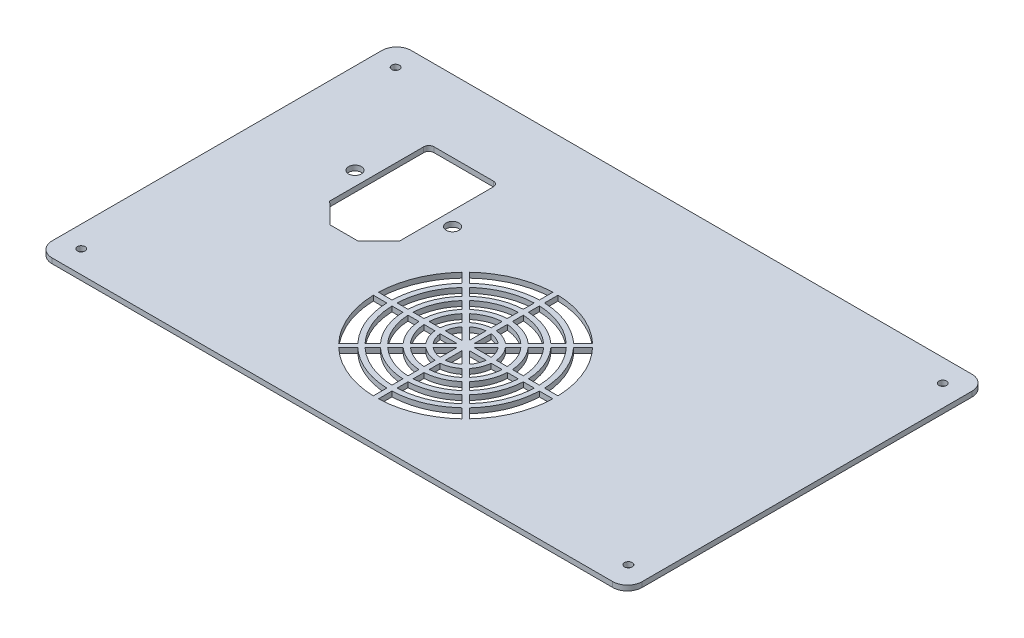
from build123d import *

# Parameters (mm, degrees)
SKETCH1_W          = 230
SKETCH1_H          = 140
BASE_FLANGE1_DEPTH = 2
SKETCH6_R          = 1.5
CUT_EXTRUDE1_DEPTH = 2
FILLET1_R          = 5.7366
SKETCH7_R          = 2.5
CUT_EXTRUDE2_DEPTH = 2
VENT1_START        = -2
VENT1_DEPTH        = 2


# Read off the part's stored shape, not the designer's step: Vent1
# Sheet-metal steps are written as plain solids
with BuildPart() as part:
    # Sketch1 → Base-Flange1 (new body)
    with BuildSketch(Plane(origin=(0, 0, 0), x_dir=(1, 0, 0), z_dir=(0, 1, 0))):
        with Locations((115, -70)):
            Rectangle(SKETCH1_W, SKETCH1_H)
    extrude(amount=-BASE_FLANGE1_DEPTH)

    # Sketch6 → Cut-Extrude1 (cut)
    with BuildSketch(Plane(origin=(0, 0, 0), x_dir=(1, 0, 0), z_dir=(0, 1, 0))):
        with Locations(Location((8.3683, -8.7366, 0), (0, 0, 270))):
            Circle(SKETCH6_R)
        with Locations(Location((221.6317, -8.7366, 0), (0, 0, 270))):
            Circle(SKETCH6_R)
        with Locations(Location((221.6317, -131.2634, 0), (0, 0, 270))):
            Circle(SKETCH6_R)
        with Locations(Location((8.3683, -131.2634, 0), (0, 0, 270))):
            Circle(SKETCH6_R)
    extrude(amount=-CUT_EXTRUDE1_DEPTH, mode=Mode.SUBTRACT)

    # Fillet1
    fillet1_edges = [part.edges().sort_by_distance(p)[0] for p in [
        (0, -1, 0),
        (230, -1, 0),
        (230, -1, 140),
        (0, -1, 140),
    ]]
    fillet(fillet1_edges, radius=FILLET1_R)

    # Sketch7 → Cut-Extrude2 (cut)
    with BuildSketch(Plane.XZ.offset(2)):
        with Locations(Location((73.235902522, 51.391264186, 0), (0, 0, 270))):
            Circle(SKETCH7_R)
        with Locations(Location((35.195902522, 51.391264186, 0), (0, 0, 270))):
            Circle(SKETCH7_R)
        with BuildLine():
            Line((67.770902522, 66.694736831), (67.770902522, 30.064484949))
            ThreePointArc((67.770902522, 30.064484949), (67.185116084, 28.650271387), (65.770902522, 28.064484949))
            Line((65.770902522, 28.064484949), (42.660902522, 28.064484949))
            ThreePointArc((42.660902522, 28.064484949), (41.246688959, 28.650271387), (40.660902522, 30.064484949))
            Line((40.660902522, 30.064484949), (40.660902522, 66.694736831))
            Line((40.660902522, 66.694736831), (48.665902522, 74.684484949))
            Line((48.665902522, 74.684484949), (59.765902522, 74.684484949))
            Line((59.765902522, 74.684484949), (67.770902522, 66.694736831))
        make_face()
    extrude(amount=-CUT_EXTRUDE2_DEPTH, mode=Mode.SUBTRACT)

    # Vent1 outline → Vent1 (cut)
    with BuildSketch(Plane(origin=(0, 0, 0), x_dir=(1, 0, 0), z_dir=(0, 1, 0)).offset(VENT1_START)):
        with BuildLine():
            Line((94.186797111, -68.665322523), (90.472699187, -64.951226366))
            add(Edge.make_bspline(
                [(90.472699187, -64.951226366), (89.128830106, -66.374339487), (86.471469748, -69.707863337), (83.374186624, -75.502472495), (81.466889147, -81.789989649), (80.988769346, -86.026184309), (80.932735322, -87.982736004)],
                knots=[0.37954792, 0.37954792, 0.37954792, 0.37954792, 0.40625, 0.4375, 0.46875, 0.495452077, 0.495452077, 0.495452077, 0.495452077], degree=3))
            Line((80.932735322, -87.982736004), (86.185261736, -87.982737116))
            add(Edge.make_bspline(
                [(94.186797111, -68.665322523), (93.08478886, -69.844177112), (90.864816202, -72.643423988), (88.255820579, -77.524511485), (86.649209074, -82.820799832), (86.239600332, -86.369923764), (86.185261736, -87.982737116)],
                knots=[0.380350766, 0.380350766, 0.380350766, 0.380350766, 0.40625, 0.4375, 0.46875, 0.49464923, 0.49464923, 0.49464923, 0.49464923], degree=3))
        make_face()
        with BuildLine():
            Line((145.651564253, -87.98273737), (150.904090665, -87.982736222))
            add(Edge.make_bspline(
                [(150.904090665, -87.982736222), (150.848056651, -86.026184454), (150.369936854, -81.789989719), (148.462639356, -75.502472495), (145.365356319, -69.707863498), (142.707996103, -66.374339774), (141.364127169, -64.951226764)],
                knots=[0.004547922, 0.004547922, 0.004547922, 0.004547922, 0.03125, 0.0625, 0.09375, 0.120452077, 0.120452077, 0.120452077, 0.120452077], degree=3))
            Line((141.364127169, -64.951226764), (137.650029337, -68.665323023))
            add(Edge.make_bspline(
                [(145.651564253, -87.98273737), (145.597225668, -86.369923933), (145.187616931, -82.820799913), (143.581005401, -77.524511485), (140.972009887, -72.64342419), (138.752037406, -69.844177471), (137.650029337, -68.665323023)],
                knots=[0.005350769, 0.005350769, 0.005350769, 0.005350769, 0.03125, 0.0625, 0.09375, 0.11964923, 0.11964923, 0.11964923, 0.11964923], degree=3))
        make_face()
        with BuildLine():
            Line((95.601006963, -110.714351941), (91.88690692, -114.428446232))
            add(Edge.make_bspline(
                [(91.88690692, -114.428446232), (93.310020042, -115.772315314), (96.643543893, -118.429675674), (102.438153053, -121.526958798), (108.725670215, -123.434256278), (112.961864884, -123.912376079), (114.918416587, -123.968410102)],
                knots=[0.62954792, 0.62954792, 0.62954792, 0.62954792, 0.65625, 0.6875, 0.71875, 0.745452078, 0.745452078, 0.745452078, 0.745452078], degree=3))
            Line((114.918416587, -123.968410102), (114.918417674, -118.715883687))
            add(Edge.make_bspline(
                [(95.601006963, -110.714351941), (96.779860455, -111.816358772), (99.579106116, -114.03633006), (104.460192043, -116.645324843), (109.75648039, -118.251936349), (113.305604322, -118.661545091), (114.918417674, -118.715883687)],
                knots=[0.630350795, 0.630350795, 0.630350795, 0.630350795, 0.65625, 0.6875, 0.71875, 0.74464923, 0.74464923, 0.74464923, 0.74464923], degree=3))
        make_face()
        with BuildLine():
            Line((114.918418359, -59.249581155), (114.91841711, -53.997054748))
            add(Edge.make_bspline(
                [(114.91841711, -53.997054748), (112.961865231, -54.053088747), (108.725670382, -54.531208536), (102.438153053, -56.438506066), (96.643544056, -59.535789103), (93.310020332, -62.19314932), (91.886907322, -63.537018253)],
                knots=[0.25454792, 0.25454792, 0.25454792, 0.25454792, 0.28125, 0.3125, 0.34375, 0.370452077, 0.370452077, 0.370452077, 0.370452077], degree=3))
            Line((91.886907322, -63.537018253), (95.601003581, -67.251116085))
            add(Edge.make_bspline(
                [(114.918418359, -59.249581155), (113.305604778, -59.303919721), (109.75648061, -59.713528449), (104.460192043, -61.320140021), (99.579104748, -63.929135536), (96.779858029, -66.149108017), (95.601003581, -67.251116085)],
                knots=[0.255350766, 0.255350766, 0.255350766, 0.255350766, 0.28125, 0.3125, 0.34375, 0.36964923, 0.36964923, 0.36964923, 0.36964923], degree=3))
        make_face()
        with BuildLine():
            Line((86.185261713, -89.982727063), (80.932735306, -89.982728313))
            add(Edge.make_bspline(
                [(80.932735306, -89.982728313), (80.988769305, -91.939280191), (81.466889094, -96.17547504), (83.374186624, -102.46299237), (86.471469661, -108.257601366), (89.128829878, -111.591125091), (90.472698811, -113.014238101)],
                knots=[0.50454792, 0.50454792, 0.50454792, 0.50454792, 0.53125, 0.5625, 0.59375, 0.620452077, 0.620452077, 0.620452077, 0.620452077], degree=3))
            Line((90.472698811, -113.014238101), (94.186793465, -109.300138441))
            add(Edge.make_bspline(
                [(86.185261713, -89.982727063), (86.239600279, -91.595540645), (86.649209007, -95.144664813), (88.255820579, -100.440953379), (90.864815359, -105.3220393), (93.08478664, -108.121284954), (94.186793465, -109.300138441)],
                knots=[0.505350766, 0.505350766, 0.505350766, 0.505350766, 0.53125, 0.5625, 0.59375, 0.619649205, 0.619649205, 0.619649205, 0.619649205], degree=3))
        make_face()
        with BuildLine():
            Line((116.918407621, -118.71588371), (116.918408895, -123.968410116))
            add(Edge.make_bspline(
                [(116.918408895, -123.968410116), (118.874960766, -123.912376116), (123.111155606, -123.434256326), (129.398672928, -121.526958798), (135.193281932, -118.429675757), (138.526805662, -115.772315534), (139.949918677, -114.428446595)],
                knots=[0.75454792, 0.75454792, 0.75454792, 0.75454792, 0.78125, 0.8125, 0.84375, 0.870452078, 0.870452078, 0.870452078, 0.870452078], degree=3))
            Line((139.949918677, -114.428446595), (136.235822399, -110.714348779))
            add(Edge.make_bspline(
                [(116.918407621, -118.71588371), (118.531221203, -118.661545144), (122.080345371, -118.251936415), (127.376633937, -116.645324843), (132.257721232, -114.036329329), (135.056967952, -111.816356848), (136.235822399, -110.714348779)],
                knots=[0.755350766, 0.755350766, 0.755350766, 0.755350766, 0.78125, 0.8125, 0.84375, 0.86964923, 0.86964923, 0.86964923, 0.86964923], degree=3))
        make_face()
        with BuildLine():
            Line((136.2358229, -67.251116554), (139.949919057, -63.537018629))
            add(Edge.make_bspline(
                [(139.949919057, -63.537018629), (138.526805935, -62.193149549), (135.193282086, -59.53578919), (129.398672928, -56.438506066), (123.111155774, -54.53120859), (118.874961114, -54.053088788), (116.918409418, -53.997054764)],
                knots=[0.12954792, 0.12954792, 0.12954792, 0.12954792, 0.15625, 0.1875, 0.21875, 0.245452077, 0.245452077, 0.245452077, 0.245452077], degree=3))
            Line((116.918409418, -53.997054764), (116.918408306, -59.249581178))
            add(Edge.make_bspline(
                [(136.2358229, -67.251116554), (135.056968311, -66.149108302), (132.257721435, -63.929135644), (127.376633937, -61.320140021), (122.080345591, -59.713528516), (118.531221658, -59.303919774), (116.918408306, -59.249581178)],
                knots=[0.130350766, 0.130350766, 0.130350766, 0.130350766, 0.15625, 0.1875, 0.21875, 0.24464923, 0.24464923, 0.24464923, 0.24464923], degree=3))
        make_face()
        with BuildLine():
            Line((137.650028869, -109.300142342), (141.36412681, -113.014238481))
            add(Edge.make_bspline(
                [(141.36412681, -113.014238481), (142.707995885, -111.591125365), (145.365356237, -108.257601521), (148.462639356, -102.46299237), (150.369936865, -96.175475112), (150.848056659, -91.93928034), (150.904090668, -89.982728536)],
                knots=[0.87954792, 0.87954792, 0.87954792, 0.87954792, 0.90625, 0.9375, 0.96875, 0.995452079, 0.995452079, 0.995452079, 0.995452079], degree=3))
            Line((150.904090668, -89.982728536), (145.651564259, -89.982727316))
            add(Edge.make_bspline(
                [(137.650028869, -109.300142342), (138.752037121, -108.121287753), (140.972009778, -105.322040877), (143.581005401, -100.440953379), (145.187616949, -95.144664894), (145.597225682, -91.595540813), (145.651564259, -89.982727316)],
                knots=[0.880350766, 0.880350766, 0.880350766, 0.880350766, 0.90625, 0.9375, 0.96875, 0.994649232, 0.994649232, 0.994649232, 0.994649232], degree=3))
        make_face()
        with BuildLine():
            Line((133.227447493, -104.877553462), (136.234960592, -107.885066499))
            add(Edge.make_bspline(
                [(136.234960592, -107.885066499), (137.244941206, -106.799390827), (139.298356202, -104.203727912), (141.721335323, -99.670652812), (143.213398497, -94.751979707), (143.596825678, -91.464585196), (143.650350168, -89.982732432)],
                knots=[0.880736599, 0.880736599, 0.880736599, 0.880736599, 0.90625, 0.9375, 0.96875, 0.994263401, 0.994263401, 0.994263401, 0.994263401], degree=3))
            Line((143.650350168, -89.982732432), (139.397084398, -89.982732389))
            add(Edge.make_bspline(
                [(133.227447493, -104.877553462), (134.042177631, -103.990225054), (135.741844588, -101.827308679), (137.769536407, -98.033764105), (139.018182863, -93.917528383), (139.345749668, -91.186269522), (139.397084398, -89.982732389)],
                knots=[0.881774646, 0.881774646, 0.881774646, 0.881774646, 0.90625, 0.9375, 0.96875, 0.993225354, 0.993225354, 0.993225354, 0.993225354], degree=3))
        make_face()
        with BuildLine():
            Line((139.397084398, -87.982732471), (143.650350168, -87.982732433))
            add(Edge.make_bspline(
                [(143.650350168, -87.982732433), (143.596825678, -86.500879669), (143.213398497, -83.213485158), (141.721335323, -78.294812053), (139.298356205, -73.761736958), (137.244941214, -71.166074047), (136.234960605, -70.08039838)],
                knots=[0.005736599, 0.005736599, 0.005736599, 0.005736599, 0.03125, 0.0625, 0.09375, 0.119263401, 0.119263401, 0.119263401, 0.119263401], degree=3))
            Line((136.234960605, -70.08039838), (133.227447497, -73.087911407))
            add(Edge.make_bspline(
                [(139.397084398, -87.982732471), (139.345749668, -86.77919534), (139.018182862, -84.047936481), (137.769536407, -79.93170076), (135.741844589, -76.138156188), (134.042177633, -73.975239813), (133.227447497, -73.087911407)],
                knots=[0.006774646, 0.006774646, 0.006774646, 0.006774646, 0.03125, 0.0625, 0.09375, 0.118225354, 0.118225354, 0.118225354, 0.118225354], degree=3))
        make_face()
        with BuildLine():
            Line((92.439741583, -89.982732389), (88.186475813, -89.982732432))
            add(Edge.make_bspline(
                [(88.186475813, -89.982732432), (88.240000302, -91.464585196), (88.623427483, -94.751979707), (90.115490657, -99.670652812), (92.538469776, -104.203727907), (94.591884767, -106.799390817), (95.601865376, -107.885066485)],
                knots=[0.505736599, 0.505736599, 0.505736599, 0.505736599, 0.53125, 0.5625, 0.59375, 0.619263401, 0.619263401, 0.619263401, 0.619263401], degree=3))
            Line((95.601865376, -107.885066485), (98.609378471, -104.877553444))
            add(Edge.make_bspline(
                [(92.439741583, -89.982732389), (92.491076312, -91.186269521), (92.818643118, -93.917528383), (94.067289573, -98.033764105), (96.094981389, -101.827308671), (97.79464834, -103.990225042), (98.609378471, -104.877553444)],
                knots=[0.506774646, 0.506774646, 0.506774646, 0.506774646, 0.53125, 0.5625, 0.59375, 0.618225354, 0.618225354, 0.618225354, 0.618225354], degree=3))
        make_face()
        with BuildLine():
            Line((98.609378474, -73.087911417), (95.601865376, -70.08039838))
            add(Edge.make_bspline(
                [(95.601865376, -70.08039838), (94.591884767, -71.166074048), (92.538469776, -73.761736958), (90.115490657, -78.294812053), (88.623427483, -83.213485158), (88.240000302, -86.500879669), (88.186475813, -87.982732433)],
                knots=[0.380736599, 0.380736599, 0.380736599, 0.380736599, 0.40625, 0.4375, 0.46875, 0.494263401, 0.494263401, 0.494263401, 0.494263401], degree=3))
            Line((88.186475813, -87.982732433), (92.439741583, -87.982732471))
            add(Edge.make_bspline(
                [(98.609378474, -73.087911417), (97.794648342, -73.975239821), (96.094981389, -76.138156192), (94.067289573, -79.93170076), (92.818643118, -84.047936481), (92.491076313, -86.77919534), (92.439741583, -87.982732471)],
                knots=[0.381774646, 0.381774646, 0.381774646, 0.381774646, 0.40625, 0.4375, 0.46875, 0.493225354, 0.493225354, 0.493225354, 0.493225354], degree=3))
        make_face()
        with BuildLine():
            Line((116.918412928, -112.461403841), (116.918412971, -116.71466961))
            add(Edge.make_bspline(
                [(116.918412971, -116.71466961), (118.400265741, -116.661145122), (121.687660259, -116.277717941), (126.606333369, -114.785654765), (131.139408465, -112.362675647), (133.735071375, -110.309260656), (134.820747043, -109.299280047)],
                knots=[0.755736599, 0.755736599, 0.755736599, 0.755736599, 0.78125, 0.8125, 0.84375, 0.869263401, 0.869263401, 0.869263401, 0.869263401], degree=3))
            Line((134.820747043, -109.299280047), (131.813234002, -106.291766952))
            add(Edge.make_bspline(
                [(116.918412928, -112.461403841), (118.121950066, -112.410069112), (120.853208934, -112.082502307), (124.969444663, -110.83385585), (128.762989229, -108.806164034), (130.9259056, -107.106497083), (131.813234002, -106.291766952)],
                knots=[0.756774646, 0.756774646, 0.756774646, 0.756774646, 0.78125, 0.8125, 0.84375, 0.868225354, 0.868225354, 0.868225354, 0.868225354], degree=3))
        make_face()
        with BuildLine():
            Line((100.023591961, -106.291766936), (97.016078924, -109.299280034))
            add(Edge.make_bspline(
                [(97.016078924, -109.299280034), (98.101754595, -110.309260648), (100.69741751, -112.362675644), (105.230492611, -114.785654765), (110.149165716, -116.27771794), (113.436560227, -116.66114512), (114.918412991, -116.71466961)],
                knots=[0.630736599, 0.630736599, 0.630736599, 0.630736599, 0.65625, 0.6875, 0.71875, 0.744263401, 0.744263401, 0.744263401, 0.744263401], degree=3))
            Line((114.918412991, -116.71466961), (114.918413029, -112.46140384))
            add(Edge.make_bspline(
                [(100.023591961, -106.291766936), (100.910920368, -107.106497073), (103.073836744, -108.80616403), (106.867381318, -110.83385585), (110.983617038, -112.082502304), (113.714875898, -112.41006911), (114.918413029, -112.46140384)],
                knots=[0.631774646, 0.631774646, 0.631774646, 0.631774646, 0.65625, 0.6875, 0.71875, 0.743225354, 0.743225354, 0.743225354, 0.743225354], degree=3))
        make_face()
        with BuildLine():
            Line((131.813234005, -71.673697916), (134.820747043, -68.666184818))
            add(Edge.make_bspline(
                [(134.820747043, -68.666184818), (133.735071375, -67.656204209), (131.139408465, -65.602789218), (126.606333369, -63.179810099), (121.687660265, -61.687746925), (118.400265754, -61.304319744), (116.91841299, -61.250795255)],
                knots=[0.130736599, 0.130736599, 0.130736599, 0.130736599, 0.15625, 0.1875, 0.21875, 0.244263401, 0.244263401, 0.244263401, 0.244263401], degree=3))
            Line((116.91841299, -61.250795255), (116.918412933, -65.504061024))
            add(Edge.make_bspline(
                [(131.813234005, -71.673697916), (130.925905602, -70.858967784), (128.762989231, -69.159300832), (124.969444663, -67.131609015), (120.853208936, -65.882962559), (118.12195007, -65.555395753), (116.918412933, -65.504061024)],
                knots=[0.131774646, 0.131774646, 0.131774646, 0.131774646, 0.15625, 0.1875, 0.21875, 0.243225354, 0.243225354, 0.243225354, 0.243225354], degree=3))
        make_face()
        with BuildLine():
            Line((114.918413034, -65.504061025), (114.918412991, -61.250795255))
            add(Edge.make_bspline(
                [(114.918412991, -61.250795255), (113.436560226, -61.304319744), (110.149165716, -61.687746925), (105.230492611, -63.179810099), (100.697417516, -65.602789218), (98.101754605, -67.656204209), (97.016078938, -68.666184818)],
                knots=[0.255736599, 0.255736599, 0.255736599, 0.255736599, 0.28125, 0.3125, 0.34375, 0.369263401, 0.369263401, 0.369263401, 0.369263401], degree=3))
            Line((97.016078938, -68.666184818), (100.023591965, -71.673697926))
            add(Edge.make_bspline(
                [(114.918413034, -65.504061025), (113.714875901, -65.555395754), (110.98361704, -65.88296256), (106.867381318, -67.131609015), (103.073836746, -69.159300834), (100.910920371, -70.85896779), (100.023591965, -71.673697926)],
                knots=[0.256774646, 0.256774646, 0.256774646, 0.256774646, 0.28125, 0.3125, 0.34375, 0.368225354, 0.368225354, 0.368225354, 0.368225354], degree=3))
        make_face()
        with BuildLine():
            Line((124.371451257, -96.021568152), (127.385651673, -99.035766676))
            add(Edge.make_bspline(
                [(127.385651673, -99.035766676), (127.823703314, -98.536044965), (128.838066301, -97.214187782), (130.098397335, -94.856274262), (130.874505355, -92.297789001), (131.091936585, -90.645831874), (131.13554391, -89.982725977)],
                knots=[0.88544388, 0.88544388, 0.88544388, 0.88544388, 0.90625, 0.9375, 0.96875, 0.98955612, 0.98955612, 0.98955612, 0.98955612], degree=3))
            Line((131.13554391, -89.982725977), (126.872822184, -89.982724157))
            add(Edge.make_bspline(
                [(124.371451257, -96.021568152), (124.618548078, -95.724819091), (125.281645675, -94.837598322), (126.14659842, -93.219385556), (126.679233737, -91.463522228), (126.83771275, -90.367281432), (126.872822184, -89.982724157)],
                knots=[0.889488586, 0.889488586, 0.889488586, 0.889488586, 0.90625, 0.9375, 0.96875, 0.985511421, 0.985511421, 0.985511421, 0.985511421], degree=3))
        make_face()
        with BuildLine():
            add(Edge.make_bspline(
                [(128.802561778, -100.452675705), (129.331470922, -99.85848889), (130.511700542, -98.332536922), (131.958067413, -95.62657483), (132.848735728, -92.690434886), (133.093198346, -90.776875559), (133.139356632, -89.982726815)],
                knots=[0.884231557, 0.884231557, 0.884231557, 0.884231557, 0.90625, 0.9375, 0.96875, 0.990768442, 0.990768442, 0.990768442, 0.990768442], degree=3))
            Line((128.802561778, -100.452675705), (131.811831191, -103.461937161))
            add(Edge.make_bspline(
                [(131.811831191, -103.461937161), (132.534878298, -102.66817195), (134.068195001, -100.70898825), (135.909866329, -97.263463537), (137.043961932, -93.524851369), (137.345095373, -91.055280657), (137.395100625, -89.982732388)],
                knots=[0.88240528, 0.88240528, 0.88240528, 0.88240528, 0.90625, 0.9375, 0.96875, 0.99259472, 0.99259472, 0.99259472, 0.99259472], degree=3))
            Line((137.395100625, -89.982732388), (133.139356632, -89.982726815))
        make_face()
        with BuildLine():
            Line((126.872822079, -87.982739563), (131.135543874, -87.982738353))
            add(Edge.make_bspline(
                [(131.135543874, -87.982738353), (131.091936538, -87.319632635), (130.874505302, -85.667675692), (130.098397335, -83.109190602), (128.838066385, -80.751277238), (127.823703528, -79.429420179), (127.38565202, -78.929698585)],
                knots=[0.010443886, 0.010443886, 0.010443886, 0.010443886, 0.03125, 0.0625, 0.09375, 0.114556114, 0.114556114, 0.114556114, 0.114556114], degree=3))
            Line((127.38565202, -78.929698585), (124.371451369, -81.943896846))
            add(Edge.make_bspline(
                [(126.872822079, -87.982739563), (126.837712641, -87.598182673), (126.679233625, -86.501942269), (126.14659842, -84.746079309), (125.281645703, -83.127866594), (124.618548148, -82.240645867), (124.371451369, -81.943896846)],
                knots=[0.014488596, 0.014488596, 0.014488596, 0.014488596, 0.03125, 0.0625, 0.09375, 0.110511411, 0.110511411, 0.110511411, 0.110511411], degree=3))
        make_face()
        with BuildLine():
            add(Edge.make_bspline(
                [(133.139356609, -87.982737658), (133.093198313, -87.188589045), (132.84873569, -85.275029852), (131.958067413, -82.338890035), (130.511700627, -79.632928103), (129.331471143, -78.10697626), (128.802562137, -77.512789563)],
                knots=[0.009231562, 0.009231562, 0.009231562, 0.009231562, 0.03125, 0.0625, 0.09375, 0.115768438, 0.115768438, 0.115768438, 0.115768438], degree=3))
            Line((133.139356609, -87.982737658), (137.395100625, -87.982732472))
            add(Edge.make_bspline(
                [(137.395100625, -87.982732472), (137.345095373, -86.910184204), (137.043961931, -84.440613494), (135.909866329, -80.702001328), (134.068195002, -77.256476616), (132.5348783, -75.297292917), (131.811831194, -74.503527707)],
                knots=[0.00740528, 0.00740528, 0.00740528, 0.00740528, 0.03125, 0.0625, 0.09375, 0.11759472, 0.11759472, 0.11759472, 0.11759472], degree=3))
            Line((131.811831194, -74.503527707), (128.802562137, -77.512789563))
        make_face()
        with BuildLine():
            Line((104.964003841, -89.982724644), (100.701282071, -89.982725982))
            add(Edge.make_bspline(
                [(100.701282071, -89.982725982), (100.744889396, -90.645831878), (100.962320626, -92.297789002), (101.738428645, -94.856274262), (102.998759598, -97.21418763), (104.013122457, -98.536044691), (104.451173967, -99.035766287)],
                knots=[0.51044388, 0.51044388, 0.51044388, 0.51044388, 0.53125, 0.5625, 0.59375, 0.614556114, 0.614556114, 0.614556114, 0.614556114], degree=3))
            Line((104.451173967, -99.035766287), (107.465374618, -96.021568026))
            add(Edge.make_bspline(
                [(104.964003841, -89.982724644), (104.999113277, -90.367281755), (105.157592291, -91.463522384), (105.690227561, -93.219385556), (106.555180279, -94.837598274), (107.218277837, -95.724819003), (107.465374618, -96.021568026)],
                knots=[0.514488586, 0.514488586, 0.514488586, 0.514488586, 0.53125, 0.5625, 0.59375, 0.610511411, 0.610511411, 0.610511411, 0.610511411], degree=3))
        make_face()
        with BuildLine():
            add(Edge.make_bspline(
                [(98.697469345, -89.982726742), (98.743627629, -90.776875511), (98.988090245, -92.690434863), (99.878758567, -95.62657483), (101.325125353, -98.332536762), (102.505354838, -99.858488605), (103.034263844, -100.452675302)],
                knots=[0.509231557, 0.509231557, 0.509231557, 0.509231557, 0.53125, 0.5625, 0.59375, 0.615768438, 0.615768438, 0.615768438, 0.615768438], degree=3))
            Line((98.697469345, -89.982726742), (94.441725355, -89.982732388))
            add(Edge.make_bspline(
                [(94.441725355, -89.982732388), (94.491730607, -91.055280658), (94.792864049, -93.524851369), (95.926959651, -97.263463537), (97.768630976, -100.708988243), (99.301947673, -102.668171937), (100.024994773, -103.461937143)],
                knots=[0.50740528, 0.50740528, 0.50740528, 0.50740528, 0.53125, 0.5625, 0.59375, 0.61759472, 0.61759472, 0.61759472, 0.61759472], degree=3))
            Line((100.024994773, -103.461937143), (103.034263844, -100.452675302))
        make_face()
        with BuildLine():
            Line((107.465374723, -81.943896713), (104.451174307, -78.929698189))
            add(Edge.make_bspline(
                [(104.451174307, -78.929698189), (104.013122667, -79.4294199), (102.998759679, -80.751277083), (101.738428645, -83.109190602), (100.962320678, -85.667675694), (100.744889442, -87.319632638), (100.701282106, -87.982738358)],
                knots=[0.38544388, 0.38544388, 0.38544388, 0.38544388, 0.40625, 0.4375, 0.46875, 0.489556114, 0.489556114, 0.489556114, 0.489556114], degree=3))
            Line((100.701282106, -87.982738358), (104.964003857, -87.982740048))
            add(Edge.make_bspline(
                [(107.465374723, -81.943896713), (107.218277902, -82.240645774), (106.555180305, -83.127866542), (105.690227561, -84.746079309), (105.157592308, -86.501942425), (104.999113293, -87.598182995), (104.964003857, -87.982740048)],
                knots=[0.389488586, 0.389488586, 0.389488586, 0.389488586, 0.40625, 0.4375, 0.46875, 0.485511411, 0.485511411, 0.485511411, 0.485511411], degree=3))
        make_face()
        with BuildLine():
            add(Edge.make_bspline(
                [(103.034264203, -77.51278916), (102.505355059, -78.106975975), (101.325125438, -79.632927943), (99.878758567, -82.338890035), (98.988090298, -85.275029829), (98.743627674, -87.188588996), (98.697469376, -87.982737584)],
                knots=[0.384231557, 0.384231557, 0.384231557, 0.384231557, 0.40625, 0.4375, 0.46875, 0.490768438, 0.490768438, 0.490768438, 0.490768438], degree=3))
            Line((103.034264203, -77.51278916), (100.024994776, -74.503527719))
            add(Edge.make_bspline(
                [(100.024994776, -74.503527719), (99.301947675, -75.297292925), (97.768630976, -77.256476621), (95.926959651, -80.702001328), (94.792864049, -84.440613494), (94.491730608, -86.910184204), (94.441725356, -87.982732472)],
                knots=[0.38240528, 0.38240528, 0.38240528, 0.38240528, 0.40625, 0.4375, 0.46875, 0.49259472, 0.49259472, 0.49259472, 0.49259472], degree=3))
            Line((94.441725356, -87.982732472), (98.697469376, -87.982737584))
        make_face()
        with BuildLine():
            Line((116.918405201, -99.937141582), (116.91840654, -104.199863351))
            add(Edge.make_bspline(
                [(116.91840654, -104.199863351), (117.581512436, -104.156256026), (119.23346956, -103.938824796), (121.79195482, -103.162716778), (124.149868185, -101.902385827), (125.471725243, -100.88802297), (125.971446838, -100.449971462)],
                knots=[0.76044388, 0.76044388, 0.76044388, 0.76044388, 0.78125, 0.8125, 0.84375, 0.864556114, 0.864556114, 0.864556114, 0.864556114], degree=3))
            Line((125.971446838, -100.449971462), (122.957248576, -97.435770811))
            add(Edge.make_bspline(
                [(116.918405201, -99.937141582), (117.302962312, -99.902032146), (118.399202942, -99.743553132), (120.155066114, -99.210917862), (121.773278829, -98.345965145), (122.660499556, -97.68286759), (122.957248576, -97.435770811)],
                knots=[0.764488586, 0.764488586, 0.764488586, 0.764488586, 0.78125, 0.8125, 0.84375, 0.860511411, 0.860511411, 0.860511411, 0.860511411], degree=3))
        make_face()
        with BuildLine():
            add(Edge.make_bspline(
                [(116.9184073, -106.203676078), (117.712556069, -106.157517794), (119.626115421, -105.913055177), (122.562255388, -105.022386856), (125.26821732, -103.57602007), (126.794169163, -102.395790585), (127.38835586, -101.866881579)],
                knots=[0.759231557, 0.759231557, 0.759231557, 0.759231557, 0.78125, 0.8125, 0.84375, 0.865768438, 0.865768438, 0.865768438, 0.865768438], degree=3))
            Line((116.9184073, -106.203676078), (116.918412927, -110.459420068))
            add(Edge.make_bspline(
                [(116.918412927, -110.459420068), (117.990961203, -110.409414817), (120.460531921, -110.108281376), (124.199144095, -108.974185771), (127.644668801, -107.132514447), (129.603852495, -105.59919775), (130.397617701, -104.876150649)],
                knots=[0.75740528, 0.75740528, 0.75740528, 0.75740528, 0.78125, 0.8125, 0.84375, 0.86759472, 0.86759472, 0.86759472, 0.86759472], degree=3))
            Line((130.397617701, -104.876150649), (127.38835586, -101.866881579))
        make_face()
        with BuildLine():
            Line((108.879577263, -97.435770693), (105.86537874, -100.449971109))
            add(Edge.make_bspline(
                [(105.86537874, -100.449971109), (106.365100453, -100.888022752), (107.686957638, -101.902385742), (110.04487116, -103.162716778), (112.603356252, -103.938824745), (114.255313196, -104.15625598), (114.918418916, -104.199863317)],
                knots=[0.63544388, 0.63544388, 0.63544388, 0.63544388, 0.65625, 0.6875, 0.71875, 0.739556114, 0.739556114, 0.739556114, 0.739556114], degree=3))
            Line((114.918418916, -104.199863317), (114.918420606, -99.937141566))
            add(Edge.make_bspline(
                [(108.879577263, -97.435770693), (109.176326326, -97.682867516), (110.063547097, -98.345965116), (111.681759867, -99.210917862), (113.437622983, -99.743553115), (114.533863553, -99.902032129), (114.918420606, -99.937141566)],
                knots=[0.639488586, 0.639488586, 0.639488586, 0.639488586, 0.65625, 0.6875, 0.71875, 0.735511411, 0.735511411, 0.735511411, 0.735511411], degree=3))
        make_face()
        with BuildLine():
            add(Edge.make_bspline(
                [(104.44846971, -101.866881214), (105.042656528, -102.39579036), (106.568608498, -103.576019983), (109.274570592, -105.022386856), (112.210710387, -105.913055125), (114.124269554, -106.157517748), (114.918418142, -106.203676047)],
                knots=[0.634231557, 0.634231557, 0.634231557, 0.634231557, 0.65625, 0.6875, 0.71875, 0.740768438, 0.740768438, 0.740768438, 0.740768438], degree=3))
            Line((104.44846971, -101.866881214), (101.439208262, -104.876150633))
            add(Edge.make_bspline(
                [(101.439208262, -104.876150633), (102.232973473, -105.59919774), (104.192157173, -107.132514443), (107.637681886, -108.974185771), (111.376294052, -110.108281373), (113.845864762, -110.409414815), (114.91841303, -110.459420067)],
                knots=[0.63240528, 0.63240528, 0.63240528, 0.63240528, 0.65625, 0.6875, 0.71875, 0.74259472, 0.74259472, 0.74259472, 0.74259472], degree=3))
            Line((114.91841303, -110.459420067), (114.918418142, -106.203676047))
        make_face()
        with BuildLine():
            Line((122.95724871, -80.529694165), (125.971447233, -77.515493749))
            add(Edge.make_bspline(
                [(125.971447233, -77.515493749), (125.471725522, -77.077442109), (124.14986834, -76.063079121), (121.79195482, -74.802748087), (119.233469729, -74.02664012), (117.581512784, -73.809208884), (116.918407065, -73.765601548)],
                knots=[0.13544388, 0.13544388, 0.13544388, 0.13544388, 0.15625, 0.1875, 0.21875, 0.239556114, 0.239556114, 0.239556114, 0.239556114], degree=3))
            Line((116.918407065, -73.765601548), (116.918405375, -78.028323299))
            add(Edge.make_bspline(
                [(122.95724871, -80.529694165), (122.660499649, -80.282597345), (121.77327888, -79.619499747), (120.155066114, -78.754547003), (118.399202998, -78.22191175), (117.302962427, -78.063432736), (116.918405375, -78.028323299)],
                knots=[0.139488586, 0.139488586, 0.139488586, 0.139488586, 0.15625, 0.1875, 0.21875, 0.235511411, 0.235511411, 0.235511411, 0.235511411], degree=3))
        make_face()
        with BuildLine():
            add(Edge.make_bspline(
                [(127.388356263, -76.098583645), (126.794169448, -75.569674501), (125.26821748, -74.389444881), (122.562255388, -72.943078009), (119.626115594, -72.05240974), (117.712556426, -71.807947116), (116.918407838, -71.761788818)],
                knots=[0.134231557, 0.134231557, 0.134231557, 0.134231557, 0.15625, 0.1875, 0.21875, 0.240768438, 0.240768438, 0.240768438, 0.240768438], degree=3))
            Line((127.388356263, -76.098583645), (130.397617704, -73.089314218))
            add(Edge.make_bspline(
                [(130.397617704, -73.089314218), (129.603852497, -72.366267117), (127.644668802, -70.832950418), (124.199144095, -68.991279093), (120.460531922, -67.85718349), (117.990961205, -67.556050048), (116.918412931, -67.506044797)],
                knots=[0.13240528, 0.13240528, 0.13240528, 0.13240528, 0.15625, 0.1875, 0.21875, 0.24259472, 0.24259472, 0.24259472, 0.24259472], degree=3))
            Line((116.918412931, -67.506044797), (116.918407838, -71.761788818))
        make_face()
        with BuildLine():
            add(Edge.make_bspline(
                [(114.918418681, -71.761788787), (114.124269912, -71.807947071), (112.21071056, -72.052409688), (109.274570592, -72.943078009), (106.56860866, -74.389444795), (105.042656818, -75.56967428), (104.44847012, -76.098583286)],
                knots=[0.259231557, 0.259231557, 0.259231557, 0.259231557, 0.28125, 0.3125, 0.34375, 0.365768438, 0.365768438, 0.365768438, 0.365768438], degree=3))
            Line((114.918418681, -71.761788787), (114.918413034, -67.506044798))
            add(Edge.make_bspline(
                [(114.918413034, -67.506044798), (113.845864765, -67.556050049), (111.376294053, -67.857183491), (107.637681886, -68.991279093), (104.192157174, -70.832950421), (102.232973475, -72.366267123), (101.439208265, -73.089314229)],
                knots=[0.25740528, 0.25740528, 0.25740528, 0.25740528, 0.28125, 0.3125, 0.34375, 0.36759472, 0.36759472, 0.36759472, 0.36759472], degree=3))
            Line((101.439208265, -73.089314229), (104.44847012, -76.098583286))
        make_face()
        with BuildLine():
            Line((114.918420779, -78.028323283), (114.918419441, -73.765601513))
            add(Edge.make_bspline(
                [(114.918419441, -73.765601513), (114.255313545, -73.809208838), (112.60335642, -74.026640069), (110.04487116, -74.802748087), (107.686957796, -76.063079038), (106.365100737, -77.077441895), (105.865379143, -77.515493402)],
                knots=[0.26044388, 0.26044388, 0.26044388, 0.26044388, 0.28125, 0.3125, 0.34375, 0.364556114, 0.364556114, 0.364556114, 0.364556114], degree=3))
            Line((105.865379143, -77.515493402), (108.879577404, -80.529694054))
            add(Edge.make_bspline(
                [(114.918420779, -78.028323283), (114.533863668, -78.063432719), (113.437623039, -78.221911733), (111.681759867, -78.754547003), (110.063547152, -79.61949972), (109.176326425, -80.282597275), (108.879577404, -80.529694054)],
                knots=[0.264488586, 0.264488586, 0.264488586, 0.264488586, 0.28125, 0.3125, 0.34375, 0.360511411, 0.360511411, 0.360511411, 0.360511411], degree=3))
        make_face()
        with BuildLine():
            Line((118.332626553, -89.982732432), (122.950046382, -94.600162569))
            add(Edge.make_bspline(
                [(122.950046382, -94.600162569), (123.109229031, -94.400913837), (123.608095067, -93.719092719), (124.286928342, -92.449084988), (124.70495191, -91.071045961), (124.834320695, -90.236173712), (124.862651703, -89.982724101)],
                knots=[0.892720395, 0.892720395, 0.892720395, 0.892720395, 0.90625, 0.9375, 0.96875, 0.982279623, 0.982279623, 0.982279623, 0.982279623], degree=3))
            Line((124.862651703, -89.982724101), (118.332626553, -89.982732432))
        make_face()
        with BuildLine():
            Line((118.332626553, -87.982732432), (124.862651515, -87.982739083))
            add(Edge.make_bspline(
                [(124.862651515, -87.982739083), (124.834320522, -87.729290037), (124.704951746, -86.894418362), (124.286928342, -85.516379877), (123.608095003, -84.246372026), (123.109228871, -83.564550809), (122.950046128, -83.365301979)],
                knots=[0.017720407, 0.017720407, 0.017720407, 0.017720407, 0.03125, 0.0625, 0.09375, 0.107279612, 0.107279612, 0.107279612, 0.107279612], degree=3))
            Line((122.950046128, -83.365301979), (118.332626553, -87.982732432))
        make_face()
        with BuildLine():
            Line((113.504199428, -89.982732432), (106.974174394, -89.982725144))
            add(Edge.make_bspline(
                [(106.974174394, -89.982725144), (107.002505393, -90.236174405), (107.131874172, -91.071046297), (107.549897639, -92.449084988), (108.228730978, -93.719092839), (108.727597109, -94.400914055), (108.886779852, -94.600162886)],
                knots=[0.517720395, 0.517720395, 0.517720395, 0.517720395, 0.53125, 0.5625, 0.59375, 0.607279612, 0.607279612, 0.607279612, 0.607279612], degree=3))
            Line((108.886779852, -94.600162886), (113.504199428, -89.982732432))
        make_face()
        with BuildLine():
            Line((113.504199428, -87.982732432), (108.886779599, -83.365302296))
            add(Edge.make_bspline(
                [(108.886779599, -83.365302296), (108.727596949, -83.564551028), (108.228730914, -84.246372146), (107.549897639, -85.516379877), (107.131874133, -86.894418698), (107.002505351, -87.729290728), (106.974174349, -87.982740124)],
                knots=[0.392720395, 0.392720395, 0.392720395, 0.392720395, 0.40625, 0.4375, 0.46875, 0.482279612, 0.482279612, 0.482279612, 0.482279612], degree=3))
            Line((106.974174349, -87.982740124), (113.504199428, -87.982732432))
        make_face()
        with BuildLine():
            Line((116.91841299, -91.396945995), (116.918405702, -97.926971029))
            add(Edge.make_bspline(
                [(116.918405702, -97.926971029), (117.171854962, -97.89864003), (118.006726855, -97.76927125), (119.384765546, -97.351247784), (120.654773396, -96.672414445), (121.336594613, -96.173548314), (121.535843444, -96.01436557)],
                knots=[0.767720395, 0.767720395, 0.767720395, 0.767720395, 0.78125, 0.8125, 0.84375, 0.857279612, 0.857279612, 0.857279612, 0.857279612], degree=3))
            Line((121.535843444, -96.01436557), (116.91841299, -91.396945995))
        make_face()
        with BuildLine():
            Line((114.91841299, -91.396945995), (110.300982846, -96.014365818))
            add(Edge.make_bspline(
                [(110.300982846, -96.014365818), (110.500231581, -96.17354847), (111.182052701, -96.672414507), (112.452060435, -97.351247784), (113.830099256, -97.76927129), (114.664971286, -97.898640072), (114.918420682, -97.926971074)],
                knots=[0.642720395, 0.642720395, 0.642720395, 0.642720395, 0.65625, 0.6875, 0.71875, 0.732279612, 0.732279612, 0.732279612, 0.732279612], degree=3))
            Line((114.918420682, -97.926971074), (114.91841299, -91.396945995))
        make_face()
        with BuildLine():
            Line((116.91841299, -86.56851887), (121.535843127, -81.951099041))
            add(Edge.make_bspline(
                [(121.535843127, -81.951099041), (121.336594395, -81.791916391), (120.654773277, -81.293050356), (119.384765546, -80.614217081), (118.006726725, -80.196193575), (117.171854695, -80.066824793), (116.918405298, -80.038493791)],
                knots=[0.142720395, 0.142720395, 0.142720395, 0.142720395, 0.15625, 0.1875, 0.21875, 0.232279612, 0.232279612, 0.232279612, 0.232279612], degree=3))
            Line((116.918405298, -80.038493791), (116.91841299, -86.56851887))
        make_face()
        with BuildLine():
            Line((114.91841299, -86.56851887), (114.918420279, -80.038493836))
            add(Edge.make_bspline(
                [(114.918420279, -80.038493836), (114.664971018, -80.066824835), (113.830099125, -80.196193614), (112.452060435, -80.614217081), (111.182052584, -81.29305042), (110.500231367, -81.791916551), (110.300982537, -81.951099294)],
                knots=[0.267720395, 0.267720395, 0.267720395, 0.267720395, 0.28125, 0.3125, 0.34375, 0.357279612, 0.357279612, 0.357279612, 0.357279612], degree=3))
            Line((110.300982537, -81.951099294), (114.91841299, -86.56851887))
        make_face()
    extrude(amount=VENT1_DEPTH, mode=Mode.SUBTRACT)


solid = part.part
